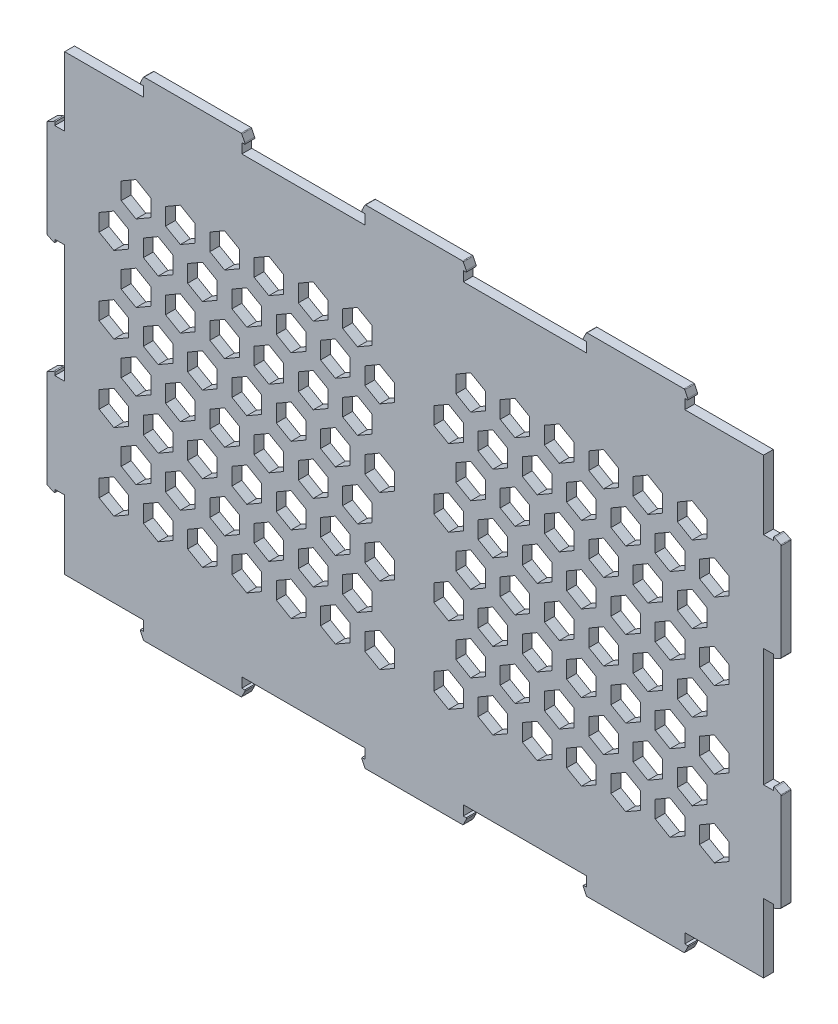
from build123d import *

# Parameters (mm, degrees)
BOSS_EXTRUDE1_DEPTH     = 2
ENL_V_MAT_EXTRU_1_DEPTH = 154.829516023


with BuildPart() as part:
    # Sketch1 → Boss-Extrude1 (new body)
    with BuildSketch(Plane.XY):
        with BuildLine():
            Line((0, 46), (0, 32))
            Line((0, 32), (-2, 32))
            Line((-2, 32), (-2, 32.6))
            ThreePointArc((-2, 32.6), (-2.15, 32.635410197), (-2.3, 32.6))
            Line((-2.3, 32.6), (-3.5, 32))
            ThreePointArc((-3.5, 32), (-3.572982477, 31.933302253), (-3.6, 31.838196601))
            Line((-3.6, 31.838196601), (-3.6, 12.161803399))
            ThreePointArc((-3.6, 12.161803399), (-3.572982477, 12.066697747), (-3.5, 12))
            Line((-3.5, 12), (-2.3, 11.4))
            ThreePointArc((-2.3, 11.4), (-2.15, 11.364589803), (-2, 11.4))
            Line((-2, 11.4), (-2, 12))
            Line((-2, 12), (0, 12))
            Line((0, 12), (0, -12))
            Line((0, -12), (-2, -12))
            Line((-2, -12), (-2, -11.4))
            ThreePointArc((-2, -11.4), (-2.15, -11.364589803), (-2.3, -11.4))
            Line((-2.3, -11.4), (-3.5, -12))
            ThreePointArc((-3.5, -12), (-3.572982477, -12.066697747), (-3.6, -12.161803399))
            Line((-3.6, -12.161803399), (-3.6, -31.838196601))
            ThreePointArc((-3.6, -31.838196601), (-3.572982477, -31.933302253), (-3.5, -32))
            Line((-3.5, -32), (-2.3, -32.6))
            ThreePointArc((-2.3, -32.6), (-2.15, -32.635410197), (-2, -32.6))
            Line((-2, -32.6), (-2, -32))
            Line((-2, -32), (0, -32))
            Line((0, -32), (0, -46))
            Line((0, -46), (16, -46))
            Line((16, -46), (16, -48))
            Line((16, -48), (15.4, -48))
            ThreePointArc((15.4, -48), (15.364589803, -48.15), (15.4, -48.3))
            Line((15.4, -48.3), (16, -49.5))
            ThreePointArc((16, -49.5), (16.066697747, -49.572982477), (16.161803399, -49.6))
            Line((16.161803399, -49.6), (35.838196601, -49.6))
            ThreePointArc((35.838196601, -49.6), (35.933302253, -49.572982477), (36, -49.5))
            Line((36, -49.5), (36.6, -48.3))
            ThreePointArc((36.6, -48.3), (36.635410197, -48.15), (36.6, -48))
            Line((36.6, -48), (36, -48))
            Line((36, -48), (36, -46))
            Line((36, -46), (61, -46))
            Line((61, -46), (61, -48))
            Line((61, -48), (60.4, -48))
            ThreePointArc((60.4, -48), (60.364589803, -48.15), (60.4, -48.3))
            Line((60.4, -48.3), (61, -49.5))
            ThreePointArc((61, -49.5), (61.066697747, -49.572982477), (61.161803399, -49.6))
            Line((61.161803399, -49.6), (80.838196601, -49.6))
            ThreePointArc((80.838196601, -49.6), (80.933302253, -49.572982477), (81, -49.5))
            Line((81, -49.5), (81.6, -48.3))
            ThreePointArc((81.6, -48.3), (81.635410197, -48.15), (81.6, -48))
            Line((81.6, -48), (81, -48))
            Line((81, -48), (81, -46))
            Line((81, -46), (106, -46))
            Line((106, -46), (106, -48))
            Line((106, -48), (105.4, -48))
            ThreePointArc((105.4, -48), (105.364589803, -48.15), (105.4, -48.3))
            Line((105.4, -48.3), (106, -49.5))
            ThreePointArc((106, -49.5), (106.066697747, -49.572982477), (106.161803399, -49.6))
            Line((106.161803399, -49.6), (125.838196601, -49.6))
            ThreePointArc((125.838196601, -49.6), (125.933302253, -49.572982477), (126, -49.5))
            Line((126, -49.5), (126.6, -48.3))
            ThreePointArc((126.6, -48.3), (126.635410197, -48.15), (126.6, -48))
            Line((126.6, -48), (126, -48))
            Line((126, -48), (126, -46))
            Line((126, -46), (142, -46))
            Line((142, -46), (142, -32))
            Line((142, -32), (144, -32))
            Line((144, -32), (144, -32.6))
            ThreePointArc((144, -32.6), (144.15, -32.635410197), (144.3, -32.6))
            Line((144.3, -32.6), (145.5, -32))
            ThreePointArc((145.5, -32), (145.572982477, -31.933302253), (145.6, -31.838196601))
            Line((145.6, -31.838196601), (145.6, -12.161803399))
            ThreePointArc((145.6, -12.161803399), (145.572982477, -12.066697747), (145.5, -12))
            Line((145.5, -12), (144.3, -11.4))
            ThreePointArc((144.3, -11.4), (144.15, -11.364589803), (144, -11.4))
            Line((144, -11.4), (144, -12))
            Line((144, -12), (142, -12))
            Line((142, -12), (142, 12))
            Line((142, 12), (144, 12))
            Line((144, 12), (144, 11.4))
            ThreePointArc((144, 11.4), (144.15, 11.364589803), (144.3, 11.4))
            Line((144.3, 11.4), (145.5, 12))
            ThreePointArc((145.5, 12), (145.572982477, 12.066697747), (145.6, 12.161803399))
            Line((145.6, 12.161803399), (145.6, 31.838196601))
            ThreePointArc((145.6, 31.838196601), (145.572982477, 31.933302253), (145.5, 32))
            Line((145.5, 32), (144.3, 32.6))
            ThreePointArc((144.3, 32.6), (144.15, 32.635410197), (144, 32.6))
            Line((144, 32.6), (144, 32))
            Line((144, 32), (142, 32))
            Line((142, 32), (142, 46))
            Line((142, 46), (126, 46))
            Line((126, 46), (126, 48))
            Line((126, 48), (126.6, 48))
            ThreePointArc((126.6, 48), (126.635410197, 48.15), (126.6, 48.3))
            Line((126.6, 48.3), (126, 49.5))
            ThreePointArc((126, 49.5), (125.933302253, 49.572982477), (125.838196601, 49.6))
            Line((125.838196601, 49.6), (106.161803399, 49.6))
            ThreePointArc((106.161803399, 49.6), (106.066697747, 49.572982477), (106, 49.5))
            Line((106, 49.5), (105.4, 48.3))
            ThreePointArc((105.4, 48.3), (105.364589803, 48.15), (105.4, 48))
            Line((105.4, 48), (106, 48))
            Line((106, 48), (106, 46))
            Line((106, 46), (81, 46))
            Line((81, 46), (81, 48))
            Line((81, 48), (81.6, 48))
            ThreePointArc((81.6, 48), (81.635410197, 48.15), (81.6, 48.3))
            Line((81.6, 48.3), (81, 49.5))
            ThreePointArc((81, 49.5), (80.933302253, 49.572982477), (80.838196601, 49.6))
            Line((80.838196601, 49.6), (61.161803399, 49.6))
            ThreePointArc((61.161803399, 49.6), (61.066697747, 49.572982477), (61, 49.5))
            Line((61, 49.5), (60.4, 48.3))
            ThreePointArc((60.4, 48.3), (60.364589803, 48.15), (60.4, 48))
            Line((60.4, 48), (61, 48))
            Line((61, 48), (61, 46))
            Line((61, 46), (36, 46))
            Line((36, 46), (36, 48))
            Line((36, 48), (36.6, 48))
            ThreePointArc((36.6, 48), (36.635410197, 48.15), (36.6, 48.3))
            Line((36.6, 48.3), (36, 49.5))
            ThreePointArc((36, 49.5), (35.933302253, 49.572982477), (35.838196601, 49.6))
            Line((35.838196601, 49.6), (16.161803399, 49.6))
            ThreePointArc((16.161803399, 49.6), (16.066697747, 49.572982477), (16, 49.5))
            Line((16, 49.5), (15.4, 48.3))
            ThreePointArc((15.4, 48.3), (15.364589803, 48.15), (15.4, 48))
            Line((15.4, 48), (16, 48))
            Line((16, 48), (16, 46))
            Line((16, 46), (0, 46))
        make_face()
    extrude(amount=BOSS_EXTRUDE1_DEPTH)

    # Esquisse1 → Enlèv. mat.-Extru.1 (cut, through all)
    with BuildSketch(Plane.XY.offset(2)):
        Polygon((135, 5.629165125), (132, 7.361215932), (129, 5.629165125), (129, 2.165063509), (132, 0.433012702), (135, 2.165063509), align=None)
        Polygon((124.5, 9.959292144), (127.5, 8.227241336), (130.5, 9.959292144), (130.5, 13.423393759), (127.5, 15.155444566), (124.5, 13.423393759), align=None)
        Polygon((126, 2.165063509), (126, 5.629165125), (123, 7.361215932), (120, 5.629165125), (120, 2.165063509), (123, 0.433012702), align=None)
        Polygon((115.5, 9.959292144), (118.5, 8.227241336), (121.5, 9.959292144), (121.5, 13.423393759), (118.5, 15.155444566), (115.5, 13.423393759), align=None)
        Polygon((111, 2.165063509), (114, 0.433012702), (117, 2.165063509), (117, 5.629165125), (114, 7.361215932), (111, 5.629165125), align=None)
        Polygon((106.5, 9.959292144), (109.5, 8.227241336), (112.5, 9.959292144), (112.5, 13.423393759), (109.5, 15.155444566), (106.5, 13.423393759), align=None)
        Polygon((102, 2.165063509), (105, 0.433012702), (108, 2.165063509), (108, 5.629165125), (105, 7.361215932), (102, 5.629165125), align=None)
        Polygon((99, 2.165063509), (99, 5.629165125), (96, 7.361215932), (93, 5.629165125), (93, 2.165063509), (96, 0.433012702), align=None)
        Polygon((88.5, 9.959292144), (91.5, 8.227241336), (94.5, 9.959292144), (94.5, 13.423393759), (91.5, 15.155444566), (88.5, 13.423393759), align=None)
        Polygon((84, 2.165063509), (87, 0.433012702), (90, 2.165063509), (90, 5.629165125), (87, 7.361215932), (84, 5.629165125), align=None)
        Polygon((79.5, 9.959292144), (82.5, 8.227241336), (85.5, 9.959292144), (85.5, 13.423393759), (82.5, 15.155444566), (79.5, 13.423393759), align=None)
        Polygon((75, 2.165063509), (78, 0.433012702), (81, 2.165063509), (81, 5.629165125), (78, 7.361215932), (75, 5.629165125), align=None)
        Polygon((103.5, 13.423393759), (100.5, 15.155444566), (97.5, 13.423393759), (97.5, 9.959292144), (100.5, 8.227241336), (103.5, 9.959292144), align=None)
        Polygon((135, 21.217622393), (132, 22.9496732), (129, 21.217622393), (129, 17.753520778), (132, 16.02146997), (135, 17.753520778), align=None)
        Polygon((124.5, 25.547749412), (127.5, 23.815698604), (130.5, 25.547749412), (130.5, 29.011851027), (127.5, 30.743901834), (124.5, 29.011851027), align=None)
        Polygon((126, 17.753520778), (126, 21.217622393), (123, 22.9496732), (120, 21.217622393), (120, 17.753520778), (123, 16.02146997), align=None)
        Polygon((115.5, 25.547749412), (118.5, 23.815698604), (121.5, 25.547749412), (121.5, 29.011851027), (118.5, 30.743901834), (115.5, 29.011851027), align=None)
        Polygon((111, 17.753520778), (114, 16.02146997), (117, 17.753520778), (117, 21.217622393), (114, 22.9496732), (111, 21.217622393), align=None)
        Polygon((106.5, 25.547749412), (109.5, 23.815698604), (112.5, 25.547749412), (112.5, 29.011851027), (109.5, 30.743901834), (106.5, 29.011851027), align=None)
        Polygon((102, 17.753520778), (105, 16.02146997), (108, 17.753520778), (108, 21.217622393), (105, 22.9496732), (102, 21.217622393), align=None)
        Polygon((99, 17.753520778), (99, 21.217622393), (96, 22.9496732), (93, 21.217622393), (93, 17.753520778), (96, 16.02146997), align=None)
        Polygon((88.5, 25.547749412), (91.5, 23.815698604), (94.5, 25.547749412), (94.5, 29.011851027), (91.5, 30.743901834), (88.5, 29.011851027), align=None)
        Polygon((84, 17.753520778), (87, 16.02146997), (90, 17.753520778), (90, 21.217622393), (87, 22.9496732), (84, 21.217622393), align=None)
        Polygon((79.5, 25.547749412), (82.5, 23.815698604), (85.5, 25.547749412), (85.5, 29.011851027), (82.5, 30.743901834), (79.5, 29.011851027), align=None)
        Polygon((75, 17.753520778), (78, 16.02146997), (81, 17.753520778), (81, 21.217622393), (78, 22.9496732), (75, 21.217622393), align=None)
        Polygon((103.5, 29.011851027), (100.5, 30.743901834), (97.5, 29.011851027), (97.5, 25.547749412), (100.5, 23.815698604), (103.5, 25.547749412), align=None)
        Polygon((135, -25.547749412), (132, -23.815698604), (129, -25.547749412), (129, -29.011851027), (132, -30.743901834), (135, -29.011851027), align=None)
        Polygon((124.5, -21.217622393), (127.5, -22.9496732), (130.5, -21.217622393), (130.5, -17.753520778), (127.5, -16.02146997), (124.5, -17.753520778), align=None)
        Polygon((126, -29.011851027), (126, -25.547749412), (123, -23.815698604), (120, -25.547749412), (120, -29.011851027), (123, -30.743901834), align=None)
        Polygon((115.5, -21.217622393), (118.5, -22.9496732), (121.5, -21.217622393), (121.5, -17.753520778), (118.5, -16.02146997), (115.5, -17.753520778), align=None)
        Polygon((111, -29.011851027), (114, -30.743901834), (117, -29.011851027), (117, -25.547749412), (114, -23.815698604), (111, -25.547749412), align=None)
        Polygon((106.5, -21.217622393), (109.5, -22.9496732), (112.5, -21.217622393), (112.5, -17.753520778), (109.5, -16.02146997), (106.5, -17.753520778), align=None)
        Polygon((102, -29.011851027), (105, -30.743901834), (108, -29.011851027), (108, -25.547749412), (105, -23.815698604), (102, -25.547749412), align=None)
        Polygon((99, -29.011851027), (99, -25.547749412), (96, -23.815698604), (93, -25.547749412), (93, -29.011851027), (96, -30.743901834), align=None)
        Polygon((88.5, -21.217622393), (91.5, -22.9496732), (94.5, -21.217622393), (94.5, -17.753520778), (91.5, -16.02146997), (88.5, -17.753520778), align=None)
        Polygon((84, -29.011851027), (87, -30.743901834), (90, -29.011851027), (90, -25.547749412), (87, -23.815698604), (84, -25.547749412), align=None)
        Polygon((79.5, -21.217622393), (82.5, -22.9496732), (85.5, -21.217622393), (85.5, -17.753520778), (82.5, -16.02146997), (79.5, -17.753520778), align=None)
        Polygon((75, -29.011851027), (78, -30.743901834), (81, -29.011851027), (81, -25.547749412), (78, -23.815698604), (75, -25.547749412), align=None)
        Polygon((103.5, -17.753520778), (100.5, -16.02146997), (97.5, -17.753520778), (97.5, -21.217622393), (100.5, -22.9496732), (103.5, -21.217622393), align=None)
        Polygon((135, -9.959292144), (132, -8.227241336), (129, -9.959292144), (129, -13.423393759), (132, -15.155444566), (135, -13.423393759), align=None)
        Polygon((124.5, -5.629165125), (127.5, -7.361215932), (130.5, -5.629165125), (130.5, -2.165063509), (127.5, -0.433012702), (124.5, -2.165063509), align=None)
        Polygon((126, -13.423393759), (126, -9.959292144), (123, -8.227241336), (120, -9.959292144), (120, -13.423393759), (123, -15.155444566), align=None)
        Polygon((115.5, -5.629165125), (118.5, -7.361215932), (121.5, -5.629165125), (121.5, -2.165063509), (118.5, -0.433012702), (115.5, -2.165063509), align=None)
        Polygon((111, -13.423393759), (114, -15.155444566), (117, -13.423393759), (117, -9.959292144), (114, -8.227241336), (111, -9.959292144), align=None)
        Polygon((106.5, -5.629165125), (109.5, -7.361215932), (112.5, -5.629165125), (112.5, -2.165063509), (109.5, -0.433012702), (106.5, -2.165063509), align=None)
        Polygon((102, -13.423393759), (105, -15.155444566), (108, -13.423393759), (108, -9.959292144), (105, -8.227241336), (102, -9.959292144), align=None)
        Polygon((99, -13.423393759), (99, -9.959292144), (96, -8.227241336), (93, -9.959292144), (93, -13.423393759), (96, -15.155444566), align=None)
        Polygon((88.5, -5.629165125), (91.5, -7.361215932), (94.5, -5.629165125), (94.5, -2.165063509), (91.5, -0.433012702), (88.5, -2.165063509), align=None)
        Polygon((84, -13.423393759), (87, -15.155444566), (90, -13.423393759), (90, -9.959292144), (87, -8.227241336), (84, -9.959292144), align=None)
        Polygon((79.5, -5.629165125), (82.5, -7.361215932), (85.5, -5.629165125), (85.5, -2.165063509), (82.5, -0.433012702), (79.5, -2.165063509), align=None)
        Polygon((75, -13.423393759), (78, -15.155444566), (81, -13.423393759), (81, -9.959292144), (78, -8.227241336), (75, -9.959292144), align=None)
        Polygon((103.5, -2.165063509), (100.5, -0.433012702), (97.5, -2.165063509), (97.5, -5.629165125), (100.5, -7.361215932), (103.5, -5.629165125), align=None)
        Polygon((7, 5.629165125), (10, 7.361215932), (13, 5.629165125), (13, 2.165063509), (10, 0.433012702), (7, 2.165063509), align=None)
        Polygon((17.5, 9.959292144), (14.5, 8.227241336), (11.5, 9.959292144), (11.5, 13.423393759), (14.5, 15.155444566), (17.5, 13.423393759), align=None)
        Polygon((16, 2.165063509), (16, 5.629165125), (19, 7.361215932), (22, 5.629165125), (22, 2.165063509), (19, 0.433012702), align=None)
        Polygon((26.5, 9.959292144), (23.5, 8.227241336), (20.5, 9.959292144), (20.5, 13.423393759), (23.5, 15.155444566), (26.5, 13.423393759), align=None)
        Polygon((31, 2.165063509), (28, 0.433012702), (25, 2.165063509), (25, 5.629165125), (28, 7.361215932), (31, 5.629165125), align=None)
        Polygon((35.5, 9.959292144), (32.5, 8.227241336), (29.5, 9.959292144), (29.5, 13.423393759), (32.5, 15.155444566), (35.5, 13.423393759), align=None)
        Polygon((40, 2.165063509), (37, 0.433012702), (34, 2.165063509), (34, 5.629165125), (37, 7.361215932), (40, 5.629165125), align=None)
        Polygon((43, 2.165063509), (43, 5.629165125), (46, 7.361215932), (49, 5.629165125), (49, 2.165063509), (46, 0.433012702), align=None)
        Polygon((53.5, 9.959292144), (50.5, 8.227241336), (47.5, 9.959292144), (47.5, 13.423393759), (50.5, 15.155444566), (53.5, 13.423393759), align=None)
        Polygon((58, 2.165063509), (55, 0.433012702), (52, 2.165063509), (52, 5.629165125), (55, 7.361215932), (58, 5.629165125), align=None)
        Polygon((62.5, 9.959292144), (59.5, 8.227241336), (56.5, 9.959292144), (56.5, 13.423393759), (59.5, 15.155444566), (62.5, 13.423393759), align=None)
        Polygon((67, 2.165063509), (64, 0.433012702), (61, 2.165063509), (61, 5.629165125), (64, 7.361215932), (67, 5.629165125), align=None)
        Polygon((38.5, 13.423393759), (41.5, 15.155444566), (44.5, 13.423393759), (44.5, 9.959292144), (41.5, 8.227241336), (38.5, 9.959292144), align=None)
        Polygon((7, 21.217622393), (10, 22.9496732), (13, 21.217622393), (13, 17.753520778), (10, 16.02146997), (7, 17.753520778), align=None)
        Polygon((17.5, 25.547749412), (14.5, 23.815698604), (11.5, 25.547749412), (11.5, 29.011851027), (14.5, 30.743901834), (17.5, 29.011851027), align=None)
        Polygon((16, 17.753520778), (16, 21.217622393), (19, 22.9496732), (22, 21.217622393), (22, 17.753520778), (19, 16.02146997), align=None)
        Polygon((26.5, 25.547749412), (23.5, 23.815698604), (20.5, 25.547749412), (20.5, 29.011851027), (23.5, 30.743901834), (26.5, 29.011851027), align=None)
        Polygon((31, 17.753520778), (28, 16.02146997), (25, 17.753520778), (25, 21.217622393), (28, 22.9496732), (31, 21.217622393), align=None)
        Polygon((35.5, 25.547749412), (32.5, 23.815698604), (29.5, 25.547749412), (29.5, 29.011851027), (32.5, 30.743901834), (35.5, 29.011851027), align=None)
        Polygon((40, 17.753520778), (37, 16.02146997), (34, 17.753520778), (34, 21.217622393), (37, 22.9496732), (40, 21.217622393), align=None)
        Polygon((43, 17.753520778), (43, 21.217622393), (46, 22.9496732), (49, 21.217622393), (49, 17.753520778), (46, 16.02146997), align=None)
        Polygon((53.5, 25.547749412), (50.5, 23.815698604), (47.5, 25.547749412), (47.5, 29.011851027), (50.5, 30.743901834), (53.5, 29.011851027), align=None)
        Polygon((58, 17.753520778), (55, 16.02146997), (52, 17.753520778), (52, 21.217622393), (55, 22.9496732), (58, 21.217622393), align=None)
        Polygon((62.5, 25.547749412), (59.5, 23.815698604), (56.5, 25.547749412), (56.5, 29.011851027), (59.5, 30.743901834), (62.5, 29.011851027), align=None)
        Polygon((67, 17.753520778), (64, 16.02146997), (61, 17.753520778), (61, 21.217622393), (64, 22.9496732), (67, 21.217622393), align=None)
        Polygon((38.5, 29.011851027), (41.5, 30.743901834), (44.5, 29.011851027), (44.5, 25.547749412), (41.5, 23.815698604), (38.5, 25.547749412), align=None)
        Polygon((7, -9.959292144), (10, -8.227241336), (13, -9.959292144), (13, -13.423393759), (10, -15.155444566), (7, -13.423393759), align=None)
        Polygon((17.5, -5.629165125), (14.5, -7.361215932), (11.5, -5.629165125), (11.5, -2.165063509), (14.5, -0.433012702), (17.5, -2.165063509), align=None)
        Polygon((16, -13.423393759), (16, -9.959292144), (19, -8.227241336), (22, -9.959292144), (22, -13.423393759), (19, -15.155444566), align=None)
        Polygon((26.5, -5.629165125), (23.5, -7.361215932), (20.5, -5.629165125), (20.5, -2.165063509), (23.5, -0.433012702), (26.5, -2.165063509), align=None)
        Polygon((31, -13.423393759), (28, -15.155444566), (25, -13.423393759), (25, -9.959292144), (28, -8.227241336), (31, -9.959292144), align=None)
        Polygon((35.5, -5.629165125), (32.5, -7.361215932), (29.5, -5.629165125), (29.5, -2.165063509), (32.5, -0.433012702), (35.5, -2.165063509), align=None)
        Polygon((40, -13.423393759), (37, -15.155444566), (34, -13.423393759), (34, -9.959292144), (37, -8.227241336), (40, -9.959292144), align=None)
        Polygon((43, -13.423393759), (43, -9.959292144), (46, -8.227241336), (49, -9.959292144), (49, -13.423393759), (46, -15.155444566), align=None)
        Polygon((53.5, -5.629165125), (50.5, -7.361215932), (47.5, -5.629165125), (47.5, -2.165063509), (50.5, -0.433012702), (53.5, -2.165063509), align=None)
        Polygon((58, -13.423393759), (55, -15.155444566), (52, -13.423393759), (52, -9.959292144), (55, -8.227241336), (58, -9.959292144), align=None)
        Polygon((62.5, -5.629165125), (59.5, -7.361215932), (56.5, -5.629165125), (56.5, -2.165063509), (59.5, -0.433012702), (62.5, -2.165063509), align=None)
        Polygon((67, -13.423393759), (64, -15.155444566), (61, -13.423393759), (61, -9.959292144), (64, -8.227241336), (67, -9.959292144), align=None)
        Polygon((38.5, -2.165063509), (41.5, -0.433012702), (44.5, -2.165063509), (44.5, -5.629165125), (41.5, -7.361215932), (38.5, -5.629165125), align=None)
        Polygon((7, -25.547749412), (10, -23.815698604), (13, -25.547749412), (13, -29.011851027), (10, -30.743901834), (7, -29.011851027), align=None)
        Polygon((17.5, -21.217622393), (14.5, -22.9496732), (11.5, -21.217622393), (11.5, -17.753520778), (14.5, -16.02146997), (17.5, -17.753520778), align=None)
        Polygon((16, -29.011851027), (16, -25.547749412), (19, -23.815698604), (22, -25.547749412), (22, -29.011851027), (19, -30.743901834), align=None)
        Polygon((26.5, -21.217622393), (23.5, -22.9496732), (20.5, -21.217622393), (20.5, -17.753520778), (23.5, -16.02146997), (26.5, -17.753520778), align=None)
        Polygon((31, -29.011851027), (28, -30.743901834), (25, -29.011851027), (25, -25.547749412), (28, -23.815698604), (31, -25.547749412), align=None)
        Polygon((35.5, -21.217622393), (32.5, -22.9496732), (29.5, -21.217622393), (29.5, -17.753520778), (32.5, -16.02146997), (35.5, -17.753520778), align=None)
        Polygon((40, -29.011851027), (37, -30.743901834), (34, -29.011851027), (34, -25.547749412), (37, -23.815698604), (40, -25.547749412), align=None)
        Polygon((43, -29.011851027), (43, -25.547749412), (46, -23.815698604), (49, -25.547749412), (49, -29.011851027), (46, -30.743901834), align=None)
        Polygon((53.5, -21.217622393), (50.5, -22.9496732), (47.5, -21.217622393), (47.5, -17.753520778), (50.5, -16.02146997), (53.5, -17.753520778), align=None)
        Polygon((58, -29.011851027), (55, -30.743901834), (52, -29.011851027), (52, -25.547749412), (55, -23.815698604), (58, -25.547749412), align=None)
        Polygon((62.5, -21.217622393), (59.5, -22.9496732), (56.5, -21.217622393), (56.5, -17.753520778), (59.5, -16.02146997), (62.5, -17.753520778), align=None)
        Polygon((67, -29.011851027), (64, -30.743901834), (61, -29.011851027), (61, -25.547749412), (64, -23.815698604), (67, -25.547749412), align=None)
        Polygon((38.5, -17.753520778), (41.5, -16.02146997), (44.5, -17.753520778), (44.5, -21.217622393), (41.5, -22.9496732), (38.5, -21.217622393), align=None)
    extrude(amount=-ENL_V_MAT_EXTRU_1_DEPTH, mode=Mode.SUBTRACT)


solid = part.part
